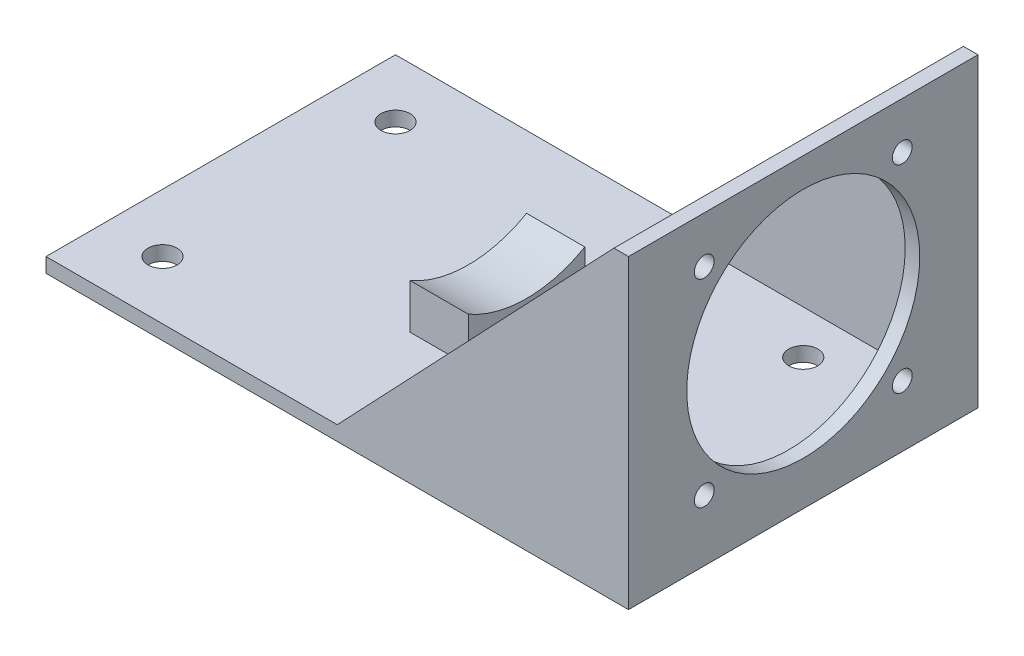
from build123d import *

# Parameters (mm, degrees)
SKETCH1_W           = 254
SKETCH1_H           = 152.4
BOSS_EXTRUDE1_DEPTH = 6.35
SKETCH2_W           = 152.4
SKETCH2_H           = 127
SKETCH2_R           = 50.8
SKETCH2_R_2         = 4.318
BOSS_EXTRUDE2_DEPTH = 6.35
BOSS_EXTRUDE3_DEPTH = 6.35
BOSS_EXTRUDE4_DEPTH = 6.35
SKETCH5_W           = 25.4
SKETCH5_H           = 50.8
BOSS_EXTRUDE5_DEPTH = 25.4
CUT_EXTRUDE1_START  = -25.4
SKETCH6_R           = 50.8
CUT_EXTRUDE1_DEPTH  = 25.4
SKETCH7_R           = 6.35
CUT_EXTRUDE2_DEPTH  = 25.4


with BuildPart() as part:
    # Sketch1 → Boss-Extrude1 (new body)
    with BuildSketch(Plane(origin=(0, 0, 0), x_dir=(1, 0, 0), z_dir=(0, 1, 0))):
        Rectangle(SKETCH1_W, SKETCH1_H)
    extrude(amount=BOSS_EXTRUDE1_DEPTH)

    # Sketch2 → Boss-Extrude2 (add)
    with BuildSketch(Plane(origin=(127, 0, 0), x_dir=(0, 0, -1), z_dir=(1, 0, 0))):
        with Locations((0, 69.85)):
            Rectangle(SKETCH2_W, SKETCH2_H)
        with Locations((0, 69.85)):
            Circle(SKETCH2_R, mode=Mode.SUBTRACT)
        with Locations((-43.18, 26.67)):
            Circle(SKETCH2_R_2, mode=Mode.SUBTRACT)
        with Locations((43.18, 26.67)):
            Circle(SKETCH2_R_2, mode=Mode.SUBTRACT)
        with Locations((43.18, 113.03)):
            Circle(SKETCH2_R_2, mode=Mode.SUBTRACT)
        with Locations((-43.18, 113.03)):
            Circle(SKETCH2_R_2, mode=Mode.SUBTRACT)
    extrude(amount=-BOSS_EXTRUDE2_DEPTH)

    # Sketch3 → Boss-Extrude3 (add)
    with BuildSketch(Plane.XY.offset(76.2)):
        Polygon((120.65, 133.35), (0, 6.35), (120.65, 6.35), align=None)
    extrude(amount=-BOSS_EXTRUDE3_DEPTH)

    # Sketch4 → Boss-Extrude4 (add)
    with BuildSketch(Plane(origin=(0, 0, -76.2), x_dir=(-1, 0, 0), z_dir=(0, 0, -1))):
        Polygon((-120.65, 133.35), (0, 6.35), (-120.65, 6.35), align=None)
    extrude(amount=-BOSS_EXTRUDE4_DEPTH)

    # Sketch5 → Boss-Extrude5 (add)
    with BuildSketch(Plane(origin=(0, 6.35, 0), x_dir=(1, 0, 0), z_dir=(0, 1, 0))):
        with Locations((-6.35, 0)):
            Rectangle(SKETCH5_W, SKETCH5_H)
    extrude(amount=BOSS_EXTRUDE5_DEPTH)

    # Sketch6 → Cut-Extrude1 (cut)
    with BuildSketch(Plane.ZY.offset(19.05).offset(CUT_EXTRUDE1_START)):
        with Locations((0, 69.85)):
            Circle(SKETCH6_R)
    extrude(amount=CUT_EXTRUDE1_DEPTH, mode=Mode.SUBTRACT)

    # Sketch7 → Cut-Extrude2 (cut)
    with BuildSketch(Plane(origin=(0, 6.35, 0), x_dir=(1, 0, 0), z_dir=(0, 1, 0))):
        with Locations((-101.6, 50.8)):
            Circle(SKETCH7_R)
        with Locations((-101.6, -50.8)):
            Circle(SKETCH7_R)
        with Locations((76.2, -50.8)):
            Circle(SKETCH7_R)
        with Locations((76.2, 50.8)):
            Circle(SKETCH7_R)
    extrude(amount=-CUT_EXTRUDE2_DEPTH, mode=Mode.SUBTRACT)


solid = part.part
